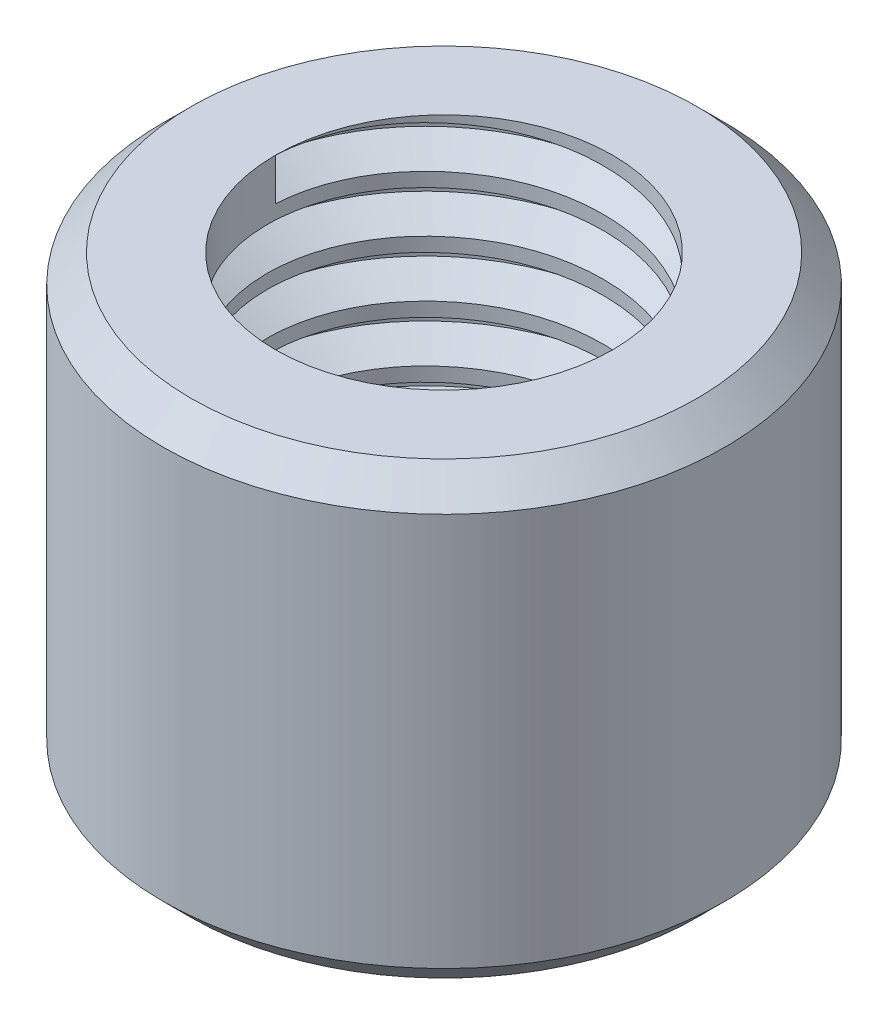
from build123d import *

# Parameters (mm, degrees)
SKETCH1_R           = 2.5
SKETCH1_R_2         = 1.5
BOSS_EXTRUDE1_DEPTH = 4
CHAMFER1_SIZE       = 0.25
THREAD1_PITCH       = 0.5


with BuildPart() as part:
    # Sketch1 → Boss-Extrude1 (new body)
    with BuildSketch(Plane(origin=(0, 0, 0), x_dir=(1, 0, 0), z_dir=(0, 1, 0))):
        with Locations(Location((0, 0, 0), (0, 0, 270))):
            Circle(SKETCH1_R)
        with Locations(Location((0, 0, 0), (0, 0, 270))):
            Circle(SKETCH1_R_2, mode=Mode.SUBTRACT)
    extrude(amount=BOSS_EXTRUDE1_DEPTH)

    # Chamfer1
    chamfer1_edges = [part.edges().sort_by_distance(p)[0] for p in [
        (0, 0, -2.5),
        (0, 4, -2.5),
    ]]
    chamfer(chamfer1_edges, length=CHAMFER1_SIZE)

    # Thread1: the profile of Thread Profile1 profile screwed along a right-hand helix of 9 turns, 6 arcs to a turn; built about Z, then put on its axis
    thread1_z = Axis((0, 0, 0), (0, 0, 1))
    thread1_corners = [(1.4997, 0, -0.000173205), (1.770632938, 0, 0.156249999), (1.770632938, 0, 0.218749999), (1.4997, 0, 0.375173204)]
    with BuildLine(mode=Mode.PRIVATE) as thread1_profile:
        Line(thread1_corners[0], thread1_corners[1])
        Line(thread1_corners[1], thread1_corners[2])
        Line(thread1_corners[2], thread1_corners[3])
        Line(thread1_corners[3], thread1_corners[0])
    thread1_cap = Face(thread1_profile.wire())
    thread1_turn_angles = [0, 30, 60, 90, 120, 150, 180, 210, 240, 270, 300, 330, 360]
    thread1_turn_weights = [1, 0.8660254037844387, 1, 0.8660254037844387, 1, 0.8660254037844387, 1, 0.8660254037844387, 1, 0.8660254037844387, 1, 0.8660254037844387, 1]
    thread1_turn_rails = [Edge.make_bspline([Vector(p[0], p[1], 0).rotate(thread1_z, thread1_turn_angles[k]) / thread1_turn_weights[k] + Vector(0, 0, p[2] + THREAD1_PITCH * thread1_turn_angles[k] / 360) for k in range(13)], [0, 0, 0, 1, 1, 2, 2, 3, 3, 4, 4, 5, 5, 6, 6, 6], 2, thread1_turn_weights) for p in thread1_corners]
    thread1_turn_sides = [Face.make_surface_from_curves(thread1_turn_rails[p[0]], thread1_turn_rails[p[1]]) for p in [(0, 1), (1, 2), (2, 3), (3, 0)]]
    thread1 = Plane(origin=(0, 4, 0), x_dir=(-1, 0, 0), z_dir=(0, -1, 0)) * Solid(Shell([*[p.moved(Location((0, 0, THREAD1_PITCH * i))) for i in range(9) for p in thread1_turn_sides], thread1_cap, thread1_cap.rotate(thread1_z, 3240).moved(Location((0, 0, THREAD1_PITCH * 3240 / 360)))]))
    add(thread1, mode=Mode.SUBTRACT)


solid = part.part
